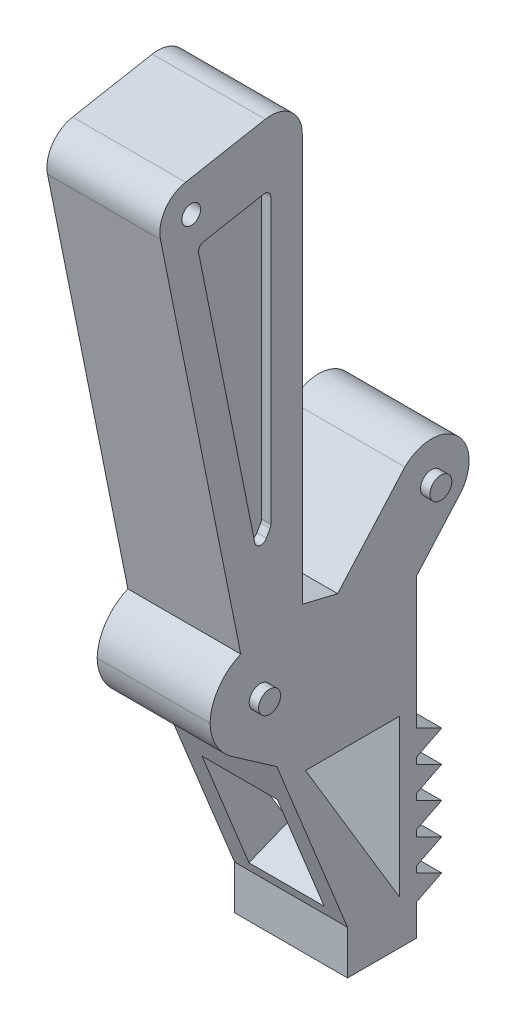
from build123d import *

# Parameters (mm, degrees)
BOSS_EXTRUDE1_DEPTH = 9
CUT_EXTRUDE1_DEPTH  = 25
BOSS_EXTRUDE2_DEPTH = 18
LPATTERN1_COUNT     = 5
LPATTERN1_PITCH     = 5
FILLET1_R           = 8
FILLET2_R           = 5
SKETCH5_R           = 1.5
CUT_EXTRUDE2_DEPTH  = 25
SKETCH8_W           = 12
SKETCH8_H           = 19.929795107
CUT_EXTRUDE4_DEPTH  = 8
SKETCH9_R           = 1.75
BOSS_EXTRUDE3_DEPTH = 1.5
SKETCH10_R          = 1.75
BOSS_EXTRUDE4_DEPTH = 1.5
CUT_EXTRUDE6_DEPTH  = 1.5


with BuildPart() as part:
    # Sketch1 → Boss-Extrude1 (new, symmetric)
    with BuildSketch(Plane(origin=(0, 0, 0), x_dir=(0, 0, -1), z_dir=(1, 0, 0))):
        Polygon((55.671385575, -3.239060519), (62.288855516, 4.258211757), (53.803574142, 12.743493131), (43.094739802, 0.610903558), (37.450270875, 1.961830752), (27.646512788, -0.009546276), (22.744633745, -0.995234789), (22.744633745, -10.995234789), (33.405472618, -18.4347586), (44.671385575, -46.239060519), (44.671385575, -53.239060519), (55.671385575, -53.239060519), align=None)
        Polygon((37.450270875, 1.961830752), (27.646512788, -0.009546276), (13.846873598, 68.616760329), (37.450270875, 72.961830752), align=None)
        with BuildLine():
            ThreePointArc((62.288855516, 4.258211757), (62.288855516, 12.743493131), (53.803574142, 12.743493131))
            Line((53.803574142, 12.743493131), (62.288855516, 4.258211757))
        make_face()
    extrude(amount=BOSS_EXTRUDE1_DEPTH, both=True)

    # Sketch3 → Cut-Extrude1 (cut)
    with BuildSketch(Plane(origin=(9, 0, 0), x_dir=(0, 0, -1), z_dir=(1, 0, 0))):
        Polygon((52.971385575, -46.239060519), (52.971385575, -21.239060519), (37.971385575, -21.239060519), align=None)
    extrude(amount=-CUT_EXTRUDE1_DEPTH, mode=Mode.SUBTRACT)

    # Sketch4 → Boss-Extrude2 (add)
    with BuildSketch(Plane(origin=(9, 0, 0), x_dir=(0, 0, -1), z_dir=(1, 0, 0))):
        Polygon((55.671385575, -44.239060519), (55.671385575, -46.239060519), (59.671385575, -46.239060519), align=None)
        Polygon((59.671385575, -46.239060519), (55.671385575, -46.239060519), (55.671385575, -48.239060519), align=None)
    boss_extrude2 = extrude(amount=-BOSS_EXTRUDE2_DEPTH)

    # LPattern1: Boss-Extrude2 ×5
    with Locations(*[(0, i * LPATTERN1_PITCH, 0) for i in range(1, LPATTERN1_COUNT)]):
        add(boss_extrude2)

    # Fillet1
    # the kernel refuses this fillet: 8 mm, written as the material it takes off along each edge
    with BuildSketch(Plane(origin=(-19.431592215, -10.995234789, -22.744633745), x_dir=(0, 1, 0), z_dir=(1, 0, 0))) as fillet1_piece_1:
        with BuildLine():
            CenterArc((FILLET1_R * 0.521579610744, -FILLET1_R), FILLET1_R, 90, 55.091253842)
            Line((-FILLET1_R * 0.298484917938, -FILLET1_R * 0.427728937655), (-FILLET1_R * 0.314886208512, -FILLET1_R * 0.416283516408))
            Line((-FILLET1_R * 0.314886208512, -FILLET1_R * 0.416283516408), (-FILLET1_R * 0.0104315922149, FILLET1_R * 0.02))
            Line((-FILLET1_R * 0.0104315922149, FILLET1_R * 0.02), (FILLET1_R * 0.521579610744, FILLET1_R * 0.02))
            Line((FILLET1_R * 0.521579610744, FILLET1_R * 0.02), (FILLET1_R * 0.521579610744, 0))
        make_face()
    extrude(amount=38.86318443, mode=Mode.SUBTRACT)
    with BuildSketch(Plane(origin=(-24.975146678, -0.995234789, -22.744633745), x_dir=(0, 0.1971377027252409, -0.9803758086388171), z_dir=(1, 0, 0))) as fillet1_piece_2:
        with BuildLine():
            CenterArc((6.583284982, -7.841760559), FILLET1_R, 101.414804466, 67.215566165)
            Line((-1.259721487, -6.264658937), (-1.416581616, -6.233116905))
            Line((-1.416581616, -6.233116905), (-0.156860129, 0.031542032))
            Line((-0.156860129, 0.031542032), (0, 0.16))
            ThreePointArc((0, 0.16), (2.5, 0.16), (4.9683343, 0.156835211))
            Line((4.9683343, 0.156835211), (5, 0))
        make_face()
    extrude(amount=49.950293357, mode=Mode.SUBTRACT)

    # Fillet2
    fillet2_edges = [part.edges().sort_by_distance(p)[0] for p in [
        (0, 68.616760329, -13.846873598),
        (0, 72.961830752, -37.450270875),
    ]]
    fillet(fillet2_edges, radius=FILLET2_R)

    # Sketch5 → Cut-Extrude2 (cut)
    with BuildSketch(Plane(origin=(9, 0, 0), x_dir=(0, 0, -1), z_dir=(1, 0, 0))):
        with Locations((19.750729409, 64.619567483)):
            Circle(SKETCH5_R)
    extrude(amount=-CUT_EXTRUDE2_DEPTH, mode=Mode.SUBTRACT)

    # Sketch8 → Cut-Extrude4 (cut)
    with BuildSketch(Plane(origin=(0, 9.02689363, -22.278396507), x_dir=(1, 0, 0), z_dir=(0, -0.3755304319039708, 0.926810063990469))):
        with Locations((0, -47.762420436)):
            Rectangle(SKETCH8_W, SKETCH8_H)
    extrude(amount=-CUT_EXTRUDE4_DEPTH, mode=Mode.SUBTRACT)

    # Sketch9 → Boss-Extrude3 (add)
    with BuildSketch(Plane(origin=(9, 0, 0), x_dir=(0, 0, -1), z_dir=(1, 0, 0))):
        with Locations((58.046214829, 8.500852444)):
            Circle(SKETCH9_R)
    boss_extrude3 = extrude(amount=BOSS_EXTRUDE3_DEPTH)

    # Sketch10 → Boss-Extrude4 (add)
    with BuildSketch(Plane(origin=(9, 0, 0), x_dir=(0, 0, -1), z_dir=(1, 0, 0))):
        with Locations((30.744633745, -7.385293461)):
            Circle(SKETCH10_R)
    boss_extrude4 = extrude(amount=BOSS_EXTRUDE4_DEPTH)

    # Sketch11 → Cut-Extrude6 (cut)
    with BuildSketch(Plane(origin=(9, 0, 0), x_dir=(0, 0, -1), z_dir=(1, 0, 0))):
        with BuildLine():
            Line((32.450270875, 60.672480234), (32.450270875, 15.509128812))
            ThreePointArc((32.450270875, 15.509128812), (32.418490768, 15.259028355), (32.325170397, 15.024824336))
            Line((32.325170397, 15.024824336), (31.735253047, 13.959134396))
            ThreePointArc((31.735253047, 13.959134396), (30.707391109, 13.455206865), (29.879977716, 14.246301169))
            Line((29.879977716, 14.246301169), (20.936945668, 58.720453776))
            ThreePointArc((20.936945668, 58.720453776), (21.089259967, 59.478228738), (21.736276876, 59.901066366))
            Line((21.736276876, 59.901066366), (31.269226274, 61.655955121))
            ThreePointArc((31.269226274, 61.655955121), (32.09017532, 61.440934723), (32.450270875, 60.672480234))
        make_face()
    cut_extrude6 = extrude(amount=-CUT_EXTRUDE6_DEPTH, mode=Mode.SUBTRACT)

    # Mirror1: Boss-Extrude3, Boss-Extrude4, Cut-Extrude6 across plane
    add(boss_extrude3.mirror(Plane(origin=(0, 0, 0), x_dir=(0, 0, 1), z_dir=(1, 0, 0))))
    add(boss_extrude4.mirror(Plane(origin=(0, 0, 0), x_dir=(0, 0, 1), z_dir=(1, 0, 0))))
    add(cut_extrude6.mirror(Plane(origin=(0, 0, 0), x_dir=(0, 0, 1), z_dir=(1, 0, 0))), mode=Mode.SUBTRACT)


solid = part.part
